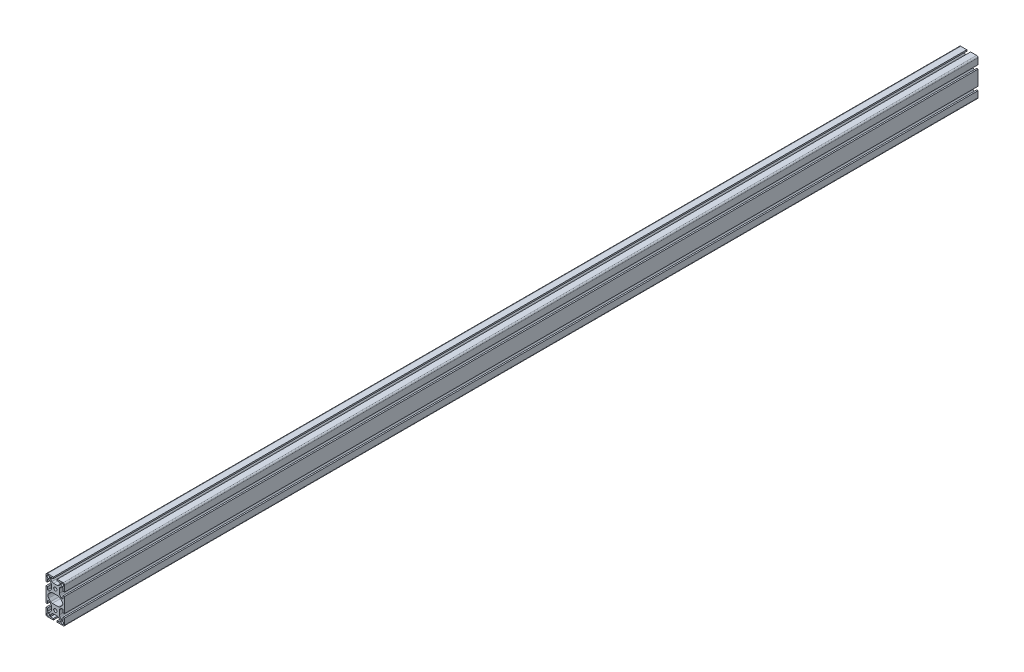
from build123d import *

# Parameters (mm, degrees)
SKETCH1_R           = 3
SKETCH1_R_2         = 3.5
BOSS_EXTRUDE1_DEPTH = 1961


with BuildPart() as part:
    # Sketch1 → Boss-Extrude1 (new body)
    with BuildSketch(Plane.XY):
        with BuildLine():
            Line((-17, -40), (-4.1, -40))
            Line((-4.1, -40), (-4.1, -37))
            Line((-4.1, -37), (-10.5, -37))
            Line((-10.5, -37), (-10.5, -33.6627417))
            ThreePointArc((-10.5, -33.6627417), (-10.378207252, -33.050448208), (-10.03137085, -32.53137085))
            Line((-10.03137085, -32.53137085), (-7.464466094, -29.964466094))
            ThreePointArc((-7.464466094, -29.964466094), (-5.84234935, -28.880602337), (-3.928932188, -28.5))
            Line((-3.928932188, -28.5), (3.928932188, -28.5))
            ThreePointArc((3.928932188, -28.5), (5.84234935, -28.880602337), (7.464466094, -29.964466094))
            Line((7.464466094, -29.964466094), (10.03137085, -32.53137085))
            ThreePointArc((10.03137085, -32.53137085), (10.378207252, -33.050448208), (10.5, -33.6627417))
            Line((10.5, -33.6627417), (10.5, -37))
            Line((10.5, -37), (4.1, -37))
            Line((4.1, -37), (4.1, -40))
            Line((4.1, -40), (17, -40))
            ThreePointArc((17, -40), (19.121320344, -39.121320344), (20, -37))
            Line((20, -37), (20, -24.1))
            Line((20, -24.1), (17, -24.1))
            Line((17, -24.1), (17, -30.5))
            Line((17, -30.5), (13.6627417, -30.5))
            ThreePointArc((13.6627417, -30.5), (13.050448208, -30.378207252), (12.53137085, -30.03137085))
            Line((12.53137085, -30.03137085), (9.964466094, -27.464466094))
            ThreePointArc((9.964466094, -27.464466094), (8.880602337, -25.84234935), (8.5, -23.928932188))
            Line((8.5, -23.928932188), (8.5, -16.071067812))
            ThreePointArc((8.5, -16.071067812), (8.880602337, -14.15765065), (9.964466094, -12.535533906))
            Line((9.964466094, -12.535533906), (12.53137085, -9.96862915))
            ThreePointArc((12.53137085, -9.96862915), (13.050448208, -9.621792748), (13.6627417, -9.5))
            Line((13.6627417, -9.5), (17, -9.5))
            Line((17, -9.5), (17, -15.9))
            Line((17, -15.9), (20, -15.9))
            Line((20, -15.9), (20, 15.9))
            Line((20, 15.9), (17, 15.9))
            Line((17, 15.9), (17, 9.5))
            Line((17, 9.5), (13.6627417, 9.5))
            ThreePointArc((13.6627417, 9.5), (13.050448208, 9.621792748), (12.53137085, 9.96862915))
            Line((12.53137085, 9.96862915), (9.964466094, 12.535533906))
            ThreePointArc((9.964466094, 12.535533906), (8.880602337, 14.15765065), (8.5, 16.071067812))
            Line((8.5, 16.071067812), (8.5, 23.928932188))
            ThreePointArc((8.5, 23.928932188), (8.880602337, 25.84234935), (9.964466094, 27.464466094))
            Line((9.964466094, 27.464466094), (12.53137085, 30.03137085))
            ThreePointArc((12.53137085, 30.03137085), (13.050448208, 30.378207252), (13.6627417, 30.5))
            Line((13.6627417, 30.5), (17, 30.5))
            Line((17, 30.5), (17, 24.1))
            Line((17, 24.1), (20, 24.1))
            Line((20, 24.1), (20, 37))
            ThreePointArc((20, 37), (19.121320344, 39.121320344), (17, 40))
            Line((17, 40), (4.1, 40))
            Line((4.1, 40), (4.1, 37))
            Line((4.1, 37), (10.5, 37))
            Line((10.5, 37), (10.5, 33.6627417))
            ThreePointArc((10.5, 33.6627417), (10.378207252, 33.050448208), (10.03137085, 32.53137085))
            Line((10.03137085, 32.53137085), (7.464466094, 29.964466094))
            ThreePointArc((7.464466094, 29.964466094), (5.84234935, 28.880602337), (3.928932188, 28.5))
            Line((3.928932188, 28.5), (-3.928932188, 28.5))
            ThreePointArc((-3.928932188, 28.5), (-5.84234935, 28.880602337), (-7.464466094, 29.964466094))
            Line((-7.464466094, 29.964466094), (-10.03137085, 32.53137085))
            ThreePointArc((-10.03137085, 32.53137085), (-10.378207252, 33.050448208), (-10.5, 33.6627417))
            Line((-10.5, 33.6627417), (-10.5, 37))
            Line((-10.5, 37), (-4.1, 37))
            Line((-4.1, 37), (-4.1, 40))
            Line((-4.1, 40), (-17, 40))
            ThreePointArc((-17, 40), (-19.121320344, 39.121320344), (-20, 37))
            Line((-20, 37), (-20, 24.1))
            Line((-20, 24.1), (-17, 24.1))
            Line((-17, 24.1), (-17, 30.5))
            Line((-17, 30.5), (-13.6627417, 30.5))
            ThreePointArc((-13.6627417, 30.5), (-13.050448208, 30.378207252), (-12.53137085, 30.03137085))
            Line((-12.53137085, 30.03137085), (-9.964466094, 27.464466094))
            ThreePointArc((-9.964466094, 27.464466094), (-8.880602337, 25.84234935), (-8.5, 23.928932188))
            Line((-8.5, 23.928932188), (-8.5, 16.071067812))
            ThreePointArc((-8.5, 16.071067812), (-8.880602337, 14.15765065), (-9.964466094, 12.535533906))
            Line((-9.964466094, 12.535533906), (-12.53137085, 9.96862915))
            ThreePointArc((-12.53137085, 9.96862915), (-13.050448208, 9.621792748), (-13.6627417, 9.5))
            Line((-13.6627417, 9.5), (-17, 9.5))
            Line((-17, 9.5), (-17, 15.9))
            Line((-17, 15.9), (-20, 15.9))
            Line((-20, 15.9), (-20, -15.9))
            Line((-20, -15.9), (-17, -15.9))
            Line((-17, -15.9), (-17, -9.5))
            Line((-17, -9.5), (-13.6627417, -9.5))
            ThreePointArc((-13.6627417, -9.5), (-13.050448208, -9.621792748), (-12.53137085, -9.96862915))
            Line((-12.53137085, -9.96862915), (-9.964466094, -12.535533906))
            ThreePointArc((-9.964466094, -12.535533906), (-8.880602337, -14.15765065), (-8.5, -16.071067812))
            Line((-8.5, -16.071067812), (-8.5, -23.928932188))
            ThreePointArc((-8.5, -23.928932188), (-8.880602337, -25.84234935), (-9.964466094, -27.464466094))
            Line((-9.964466094, -27.464466094), (-12.53137085, -30.03137085))
            ThreePointArc((-12.53137085, -30.03137085), (-13.050448208, -30.378207252), (-13.6627417, -30.5))
            Line((-13.6627417, -30.5), (-17, -30.5))
            Line((-17, -30.5), (-17, -24.1))
            Line((-17, -24.1), (-20, -24.1))
            Line((-20, -24.1), (-20, -37))
            ThreePointArc((-20, -37), (-19.121320344, -39.121320344), (-17, -40))
        make_face()
        with Locations((15, 35)):
            Circle(SKETCH1_R, mode=Mode.SUBTRACT)
        with Locations((15, -35)):
            Circle(SKETCH1_R, mode=Mode.SUBTRACT)
        with Locations((0, 20)):
            Circle(SKETCH1_R_2, mode=Mode.SUBTRACT)
        with Locations((0, -20)):
            Circle(SKETCH1_R_2, mode=Mode.SUBTRACT)
        with Locations((-15, 35)):
            Circle(SKETCH1_R, mode=Mode.SUBTRACT)
        with Locations((-15, -35)):
            Circle(SKETCH1_R, mode=Mode.SUBTRACT)
        with BuildLine():
            Line((-14.242640687, -4.242640687), (-9.949747468, -8.535533906))
            ThreePointArc((-9.949747468, -8.535533906), (-8.327630724, -9.619397663), (-6.414213562, -10))
            Line((-6.414213562, -10), (6.414213562, -10))
            ThreePointArc((6.414213562, -10), (8.327630724, -9.619397663), (9.949747468, -8.535533906))
            Line((9.949747468, -8.535533906), (14.242640687, -4.242640687))
            ThreePointArc((14.242640687, -4.242640687), (16, 0), (14.242640687, 4.242640687))
            Line((14.242640687, 4.242640687), (9.949747468, 8.535533906))
            ThreePointArc((9.949747468, 8.535533906), (8.327630724, 9.619397663), (6.414213562, 10))
            Line((6.414213562, 10), (-6.414213562, 10))
            ThreePointArc((-6.414213562, 10), (-8.327630724, 9.619397663), (-9.949747468, 8.535533906))
            Line((-9.949747468, 8.535533906), (-14.242640687, 4.242640687))
            ThreePointArc((-14.242640687, 4.242640687), (-16, 0), (-14.242640687, -4.242640687))
        make_face(mode=Mode.SUBTRACT)
    extrude(amount=-BOSS_EXTRUDE1_DEPTH)


solid = part.part
